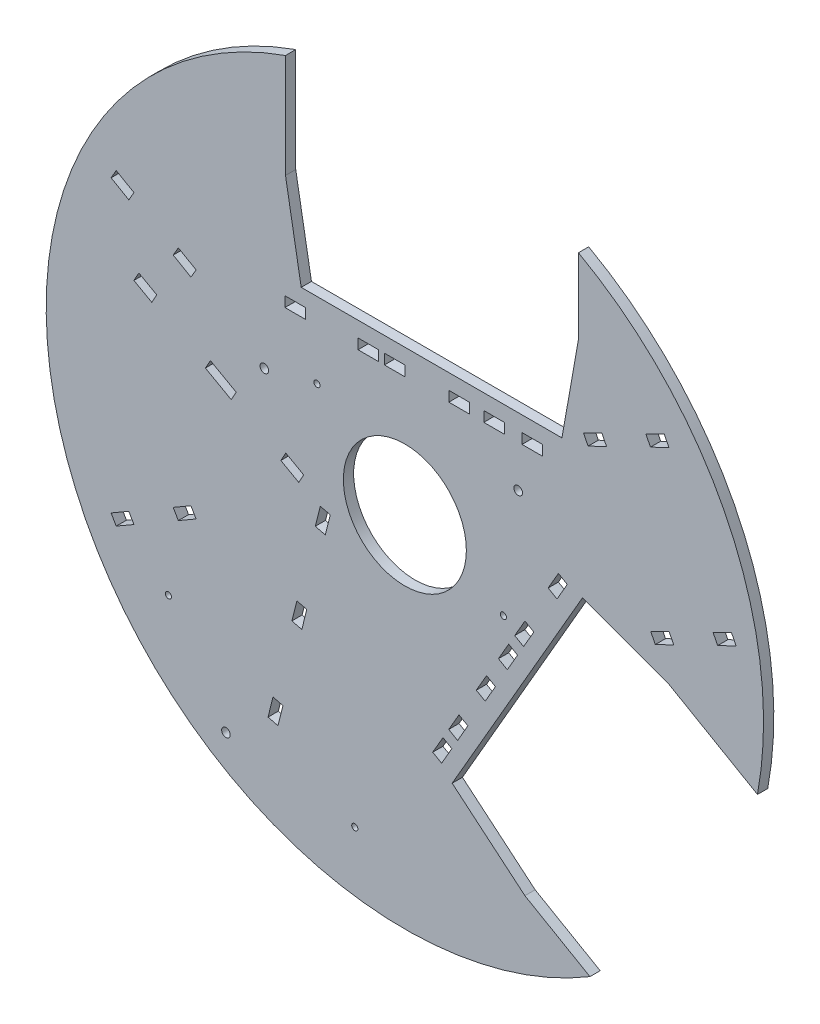
from build123d import *

# Parameters (mm, degrees)
ESQUISSE1_R             = 175
BOSS_EXTRU_1_DEPTH      = 5
ENL_V_MAT_EXTRU_1_DEPTH = 5
ESQUISSE3_W             = 10
ESQUISSE3_H             = 5
ENL_V_MAT_EXTRU_2_DEPTH = 10
ESQUISSE4_R             = 1.5
ENL_V_MAT_EXTRU_3_DEPTH = 10
ENL_V_MAT_EXTRU_4_DEPTH = 10
ESQUISSE6_W             = 10
ESQUISSE6_H             = 5
ENL_V_MAT_EXTRU_5_DEPTH = 5
TROU_TARAUD_M51_D       = 4.2
ESQUISSE10_R            = 30
ENL_V_MAT_EXTRU_6_DEPTH = 5


with BuildPart() as part:
    # Esquisse1 → Boss.-Extru.1 (new body)
    with BuildSketch(Plane.XY):
        Circle(ESQUISSE1_R)
    extrude(amount=BOSS_EXTRU_1_DEPTH)

    # Esquisse2 → Enlèv. mat.-Extru.1 (cut)
    with BuildSketch(Plane(origin=(0, 0, 0), x_dir=(-1, 0, 0), z_dir=(0, 0, -1))):
        Polygon((58.240826849, 114.332025077), (58.240826849, 213.87663255), (-84.681680643, 213.87663255), (-84.681680643, 116.513512453), (-76.636603499, 70.887612711), (50.580404788, 70.887612711), align=None)
        Polygon((-128.134851608, -6.727976949), (-214.343010489, -56.500280686), (-142.881756743, -180.274802947), (-58.562821347, -131.593242898), (-23.072171671, -101.813051845), (-86.680675815, 8.360109125), align=None)
    extrude(amount=-ENL_V_MAT_EXTRU_1_DEPTH, mode=Mode.SUBTRACT)

    # Esquisse3 → Enlèv. mat.-Extru.2 (cut)
    with BuildSketch(Plane.XY.offset(5)):
        Polygon((-49.356660547, -7.757843325), (-58.077491782, -2.864265639), (-60.524280625, -7.224681256), (-51.803449391, -12.118258943), align=None)
        Polygon((-82.29909118, 10.727360567), (-94.870678761, 17.781738621), (-97.317467605, 13.421323004), (-84.745880023, 6.36694495), align=None)
        Polygon((-121.033172465, 32.462471681), (-129.7540037, 37.356049368), (-132.200792544, 32.995633751), (-123.479961309, 28.102056064), align=None)
        Polygon((-36.411918308, -18.139201989), (-38.839769225, -27.840002983), (-43.690169722, -26.626077525), (-41.262318805, -16.925276531), align=None)
        Polygon((-47.8486979, -63.836374764), (-50.276548817, -73.537175758), (-55.126949314, -72.323250299), (-52.699098397, -62.622449305), align=None)
        Polygon((-59.476502021, -110.296811432), (-61.904352938, -119.997612426), (-66.754753435, -118.783686967), (-64.326902518, -109.082885973), align=None)
        Polygon((62.914433511, -18.00423005), (58.584306492, -15.50423005), (53.584306492, -24.164484088), (57.914433511, -26.664484088), align=None)
        Polygon((39.851125271, -47.951051713), (44.18125229, -50.451051713), (39.18125229, -59.11130575), (34.851125271, -56.61130575), align=None)
        Polygon((18.584306492, -84.786262353), (22.914433511, -87.286262353), (17.914433511, -95.946516391), (13.584306492, -93.446516391), align=None)
        with Locations((62.155135581, 60.887612711)):
            Rectangle(ESQUISSE3_W, ESQUISSE3_H)
        with Locations((-17.844864419, 60.887612711)):
            Rectangle(ESQUISSE3_W, ESQUISSE3_H)
        with Locations((26.44406925, 60.887612711)):
            Rectangle(ESQUISSE3_W, ESQUISSE3_H)
        Polygon((122.148385312, 6.310171572), (119.963600629, 10.807583704), (128.958424895, 15.177153069), (131.143209577, 10.679740937), align=None)
        Polygon((159.379066535, 29.955107573), (150.38424227, 25.585538209), (152.569026952, 21.088126076), (161.563851217, 25.457695441), align=None)
        Polygon((126.607296299, 97.416289564), (117.612472034, 93.046720199), (119.797256716, 88.549308067), (128.792080981, 92.918877432), align=None)
        Polygon((96.186654659, 82.63833506), (98.371439341, 78.140922927), (89.376615076, 73.771353563), (87.191830393, 78.268765695), align=None)
    extrude(amount=-ENL_V_MAT_EXTRU_2_DEPTH, mode=Mode.SUBTRACT)

    # Esquisse4 → Enlèv. mat.-Extru.3 (cut)
    with BuildSketch(Plane(origin=(0, 0, 0), x_dir=(-1, 0, 0), z_dir=(0, 0, -1))):
        with Locations((115.362702052, -91.589286674)):
            Circle(ESQUISSE4_R)
        with Locations((24.430034655, -144.089286674)):
            Circle(ESQUISSE4_R)
        with Locations((-48.069965345, -18.515603125)):
            Circle(ESQUISSE4_R)
        with Locations((42.862702052, 33.984396875)):
            Circle(ESQUISSE4_R)
    extrude(amount=-ENL_V_MAT_EXTRU_3_DEPTH, mode=Mode.SUBTRACT)

    # Esquisse5 → Enlèv. mat.-Extru.4 (cut)
    with BuildSketch(Plane(origin=(0, 0, 0), x_dir=(-1, 0, 0), z_dir=(0, 0, -1))):
        Polygon((132.178427666, -70.125229259), (134.678427666, -65.79510224), (143.338681704, -70.79510224), (140.838681704, -75.125229259), align=None)
        Polygon((110.527792572, -57.625229259), (113.027792572, -53.29510224), (104.367538534, -48.29510224), (101.867538534, -52.625229259), align=None)
        Polygon((134.678427666, 65.79510224), (132.178427666, 70.125229259), (140.838681704, 75.125229259), (143.338681704, 70.79510224), align=None)
        Polygon((110.527792572, 57.625229259), (113.027792572, 53.29510224), (104.367538534, 48.29510224), (101.867538534, 52.625229259), align=None)
    extrude(amount=-ENL_V_MAT_EXTRU_4_DEPTH, mode=Mode.SUBTRACT)

    # Esquisse6 → Enlèv. mat.-Extru.5 (cut)
    with BuildSketch(Plane.XY.offset(5)):
        Polygon((25.731885433, -82.406292477), (30.731885433, -73.746038439), (26.401758414, -71.246038439), (21.401758414, -79.906292477), align=None)
        Polygon((49.981885433, -40.404060393), (54.981885433, -31.743806355), (50.651758414, -29.243806355), (45.651758414, -37.904060393), align=None)
        with Locations((43.5, 60.887612711)):
            Rectangle(ESQUISSE6_W, ESQUISSE6_H)
        Polygon((74.901758414, 12.758425728), (69.901758414, 4.09817169), (74.231885433, 1.59817169), (79.231885433, 10.258425728), align=None)
        with Locations((-5, 60.887612711)):
            Rectangle(ESQUISSE6_W, ESQUISSE6_H)
        with Locations((-53.5, 60.887612711)):
            Rectangle(ESQUISSE6_W, ESQUISSE6_H)
    extrude(amount=-ENL_V_MAT_EXTRU_5_DEPTH, mode=Mode.SUBTRACT)

    # Trou taraudé M51 (through all)
    with Locations(Plane(origin=(0, 0, -85), x_dir=(1, 0, 0), z_dir=(0, 0, -1))):
        with Locations((-68.568956805, -27.662548456), (55.280905682, -37.98337033), (-87.299337242, 135.559338217)):
            Hole(TROU_TARAUD_M51_D / 2)

    # Esquisse10 → Enlèv. mat.-Extru.6 (cut)
    with BuildSketch(Plane.XY.offset(5)):
        Circle(ESQUISSE10_R)
    extrude(amount=-ENL_V_MAT_EXTRU_6_DEPTH, mode=Mode.SUBTRACT)


solid = part.part
